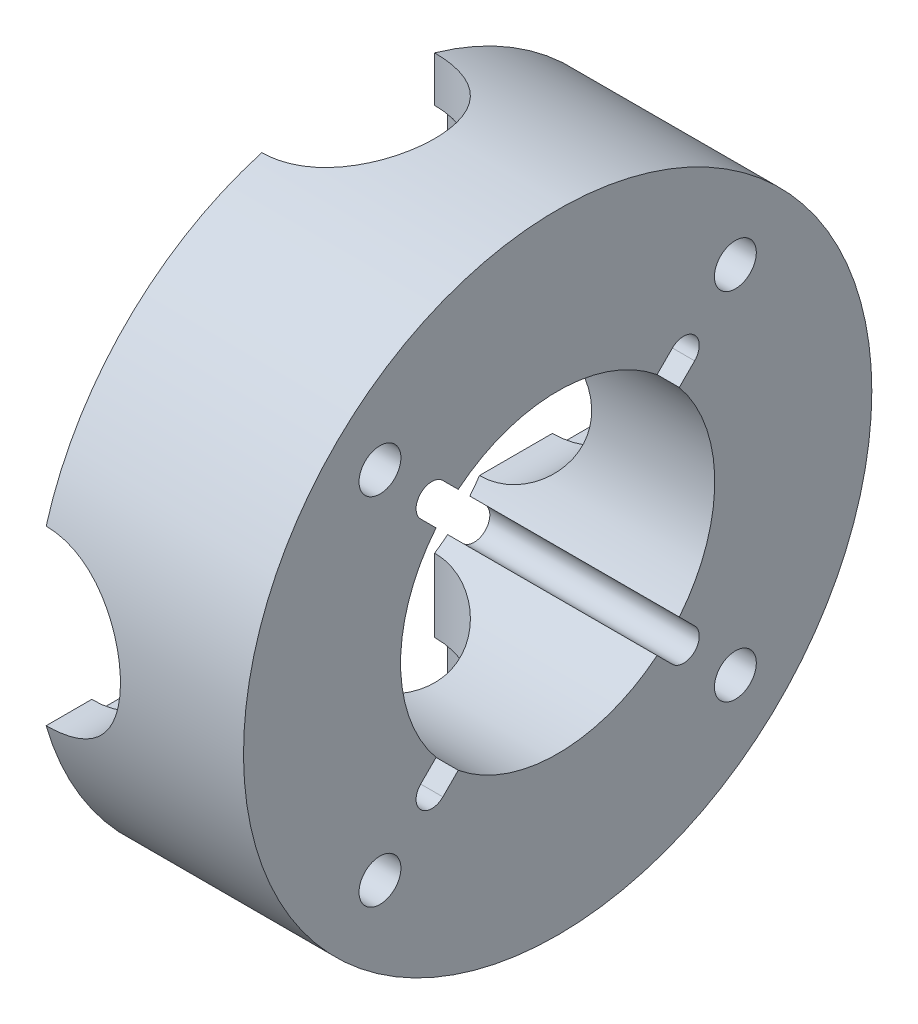
from build123d import *

# Parameters (mm, degrees)
SKETCH1_R           = 30
SKETCH1_R_2         = 15
BOSS_EXTRUDE1_DEPTH = 40
SKETCH2_R           = 9.5
CUT_EXTRUDE1_DEPTH  = 2.5
SKETCH3_R           = 8.25
CUT_EXTRUDE2_DEPTH  = 15
CIRPATTERN1_COUNT   = 4
SKETCH4_R           = 2
CUT_EXTRUDE3_DEPTH  = 47.904157769
CUT_EXTRUDE4_DEPTH  = 47.904157769


with BuildPart() as part:
    # Sketch1 → Boss-Extrude1 (new body)
    with BuildSketch(Plane(origin=(0, 0, 0), x_dir=(0, 0, -1), z_dir=(1, 0, 0))):
        Circle(SKETCH1_R)
        Circle(SKETCH1_R_2, mode=Mode.SUBTRACT)
    extrude(amount=BOSS_EXTRUDE1_DEPTH)

    # Sketch2 → Cut-Extrude1 (cut, symmetric)
    with BuildSketch(Plane.XY.offset(22)):
        with Locations((20, 0)):
            Circle(SKETCH2_R)
    cut_extrude1 = extrude(amount=CUT_EXTRUDE1_DEPTH, both=True, mode=Mode.SUBTRACT)

    # Sketch3 → Cut-Extrude2 (cut, symmetric)
    with BuildSketch(Plane.XY.offset(22)):
        with Locations((20, 0)):
            Circle(SKETCH3_R)
    cut_extrude2 = extrude(amount=CUT_EXTRUDE2_DEPTH, both=True, mode=Mode.SUBTRACT)

    # CirPattern1: Cut-Extrude1, Cut-Extrude2 ×4 about axis
    cirpattern1_axis = Axis((40, 0, 0), (1, 0, 0))
    add([cut_extrude1.rotate(cirpattern1_axis, i * 360 / CIRPATTERN1_COUNT) for i in range(1, CIRPATTERN1_COUNT)], mode=Mode.SUBTRACT)
    add([cut_extrude2.rotate(cirpattern1_axis, i * 360 / CIRPATTERN1_COUNT) for i in range(1, CIRPATTERN1_COUNT)], mode=Mode.SUBTRACT)


with BuildPart() as body_2:
    # Split2: the piece on the far side of the plane
    add(part.part)
    split(bisect_by=Plane(origin=(20, 0, 0), x_dir=(0, 0, 1), z_dir=(1, 0, 0)), keep=Keep.BOTTOM)


with BuildPart() as part_1:
    add(part.part)

    # Split2
    split(bisect_by=Plane(origin=(20, 0, 0), x_dir=(0, 0, 1), z_dir=(1, 0, 0)), keep=Keep.TOP)

    # Sketch4 → Cut-Extrude3 (cut, through all)
    with BuildSketch(Plane(origin=(40, 0, 0), x_dir=(0, 0, -1), z_dir=(1, 0, 0))):
        with Locations((-16.970562748, 16.970562748)):
            Circle(SKETCH4_R)
        with Locations((16.970562748, 16.970562748)):
            Circle(SKETCH4_R)
        with Locations((16.970562748, -16.970562748)):
            Circle(SKETCH4_R)
        with Locations((-16.970562748, -16.970562748)):
            Circle(SKETCH4_R)
    extrude(amount=-CUT_EXTRUDE3_DEPTH, mode=Mode.SUBTRACT)

    # Sketch5 → Cut-Extrude4 (cut, through all)
    with BuildSketch(Plane.ZY.offset(-20)):
        with BuildLine():
            Line((-9.830247237, 7.708926893), (-8.769587065, 8.769587065))
            Line((-8.769587065, 8.769587065), (-7.708926893, 9.830247237))
            Line((-7.708926893, 9.830247237), (-10.960155108, 13.081475452))
            ThreePointArc((-10.960155108, 13.081475452), (-13.081475452, 13.081475452), (-13.081475452, 10.960155108))
            Line((-13.081475452, 10.960155108), (-9.830247237, 7.708926893))
        make_face()
        with BuildLine():
            ThreePointArc((13.081475452, 10.960155108), (13.081475452, 13.081475452), (10.960155108, 13.081475452))
            Line((10.960155108, 13.081475452), (7.708926893, 9.830247237))
            Line((7.708926893, 9.830247237), (9.830247237, 7.708926893))
            Line((9.830247237, 7.708926893), (13.081475452, 10.960155108))
        make_face()
        with BuildLine():
            ThreePointArc((10.960155108, -13.081475452), (13.081475452, -13.081475452), (13.081475452, -10.960155108))
            Line((13.081475452, -10.960155108), (9.830247237, -7.708926893))
            Line((9.830247237, -7.708926893), (7.708926893, -9.830247237))
            Line((7.708926893, -9.830247237), (10.960155108, -13.081475452))
        make_face()
        with BuildLine():
            ThreePointArc((-13.081475452, -10.960155108), (-13.081475452, -13.081475452), (-10.960155108, -13.081475452))
            Line((-10.960155108, -13.081475452), (-7.708926893, -9.830247237))
            Line((-7.708926893, -9.830247237), (-9.830247237, -7.708926893))
            Line((-9.830247237, -7.708926893), (-13.081475452, -10.960155108))
        make_face()
    extrude(amount=-CUT_EXTRUDE4_DEPTH, mode=Mode.SUBTRACT)


solid = part_1.part
